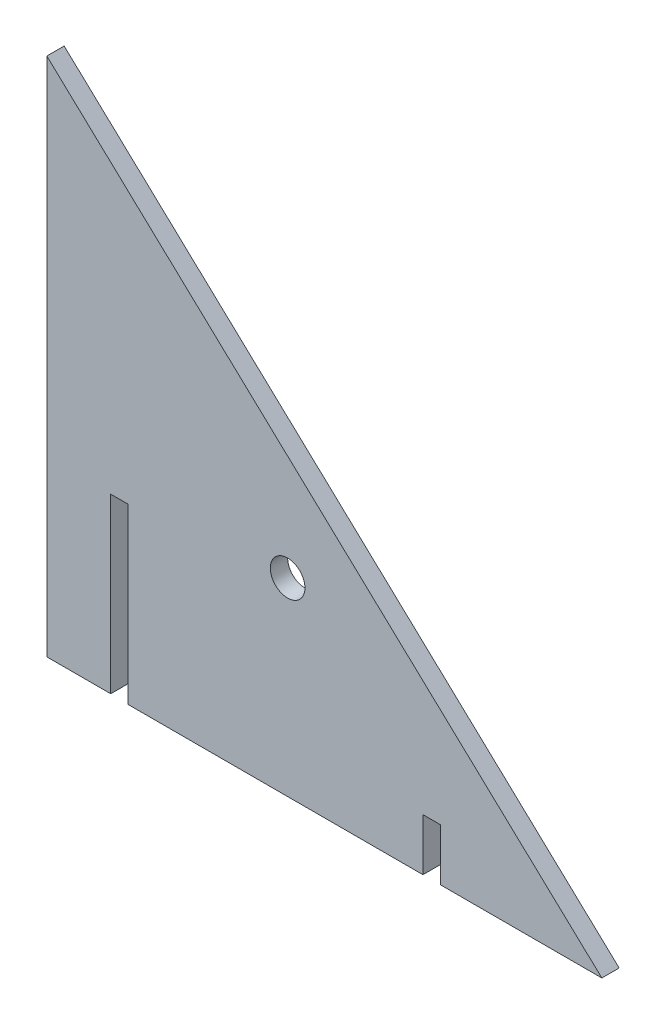
from build123d import *

# Parameters (mm, degrees)
BOSS_EXTRUDE1_START = 63.5
BOSS_EXTRUDE1_DEPTH = 12.7
CAVITY1_START       = 63.5
CAVITY1_OUTLINE_R   = 12.7
CAVITY1_DEPTH       = 12.7


# Read off the part's stored shape, not the designer's step: Cavity1
with BuildPart() as part:
    # Sketch1 → Boss-Extrude1 (new body)
    with BuildSketch(Plane.XY.offset(BOSS_EXTRUDE1_START)):
        Polygon((2188.405431846, 757.059372145), (2594.805431846, 375.625791085), (2476.5, 375.625791085), (2476.5, 413.725791085), (2463.8, 413.725791085), (2463.8, 375.625791085), (2247.9, 375.625791085), (2247.9, 502.625791085), (2235.2, 502.625791085), (2235.2, 376.059372145), (2188.405431846, 376.059372145), align=None)
    extrude(amount=BOSS_EXTRUDE1_DEPTH)

    # Cavity1 outline → Cavity1 (cut)
    with BuildSketch(Plane.XY.offset(CAVITY1_START)):
        with Locations((2364.733137895, 514.21976629)):
            Circle(CAVITY1_OUTLINE_R)
    extrude(amount=CAVITY1_DEPTH, mode=Mode.SUBTRACT)


solid = part.part
